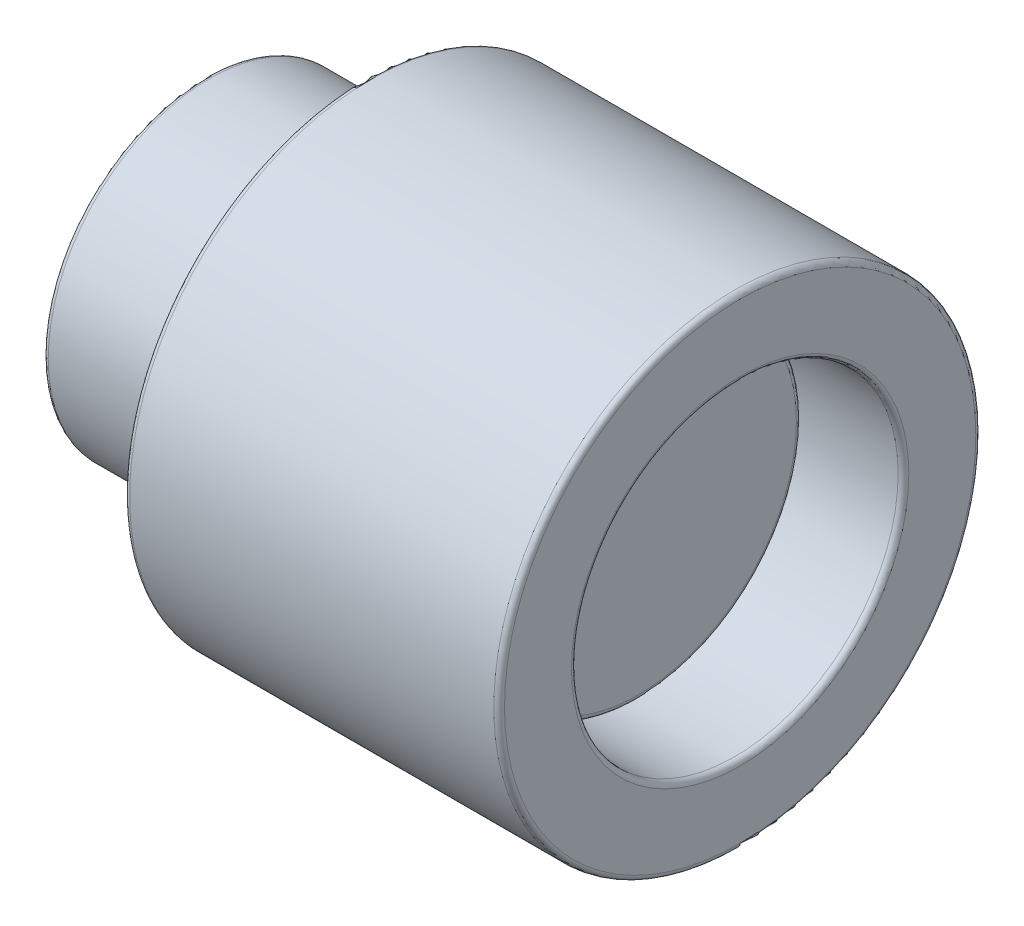
from build123d import *

# Parameters (mm, degrees)
SKETCH_1_R           = 4.5
SKETCH_1_R_2         = 3.05
EXTRUDE_1_DEPTH      = 7
EXTRUDE_2_DEPTH      = 3
EXTRUDE_2_DEPTH_BACK = 5.1
SKETCH_2_R           = 3.05
SKETCH_3_R           = 3.05
SKETCH_3_R_2         = 3.02
CUT_EXTRUDE_1_DEPTH  = 3
FILLET_1_R           = 0.1
FILLET_2_R           = 0.1
FILLET_3_R           = 0.1
FILLET_4_R           = 0.1


with BuildPart() as part:
    # 草图1 → 凸台-拉伸1 (new body)
    with BuildSketch(Plane(origin=(0, 0, 0), x_dir=(0, 0, -1), z_dir=(1, 0, 0))):
        Circle(SKETCH_1_R)
        Circle(SKETCH_1_R_2, mode=Mode.SUBTRACT)
    extrude(amount=EXTRUDE_1_DEPTH)

    # 圆角1
    fillet_1_edges = [part.edges().sort_by_distance(p)[0] for p in [
        (0, 0, 4.5),
        (7, 0, 4.5),
        (7, 0, 3.05),
    ]]
    fillet(fillet_1_edges, radius=FILLET_1_R)


with BuildPart() as body_2:
    # 草图2 → 凸台-拉伸2 (new, two sides: drawn at the far end of the back side and taken through both)
    with BuildSketch(Plane.ZY.offset(-EXTRUDE_2_DEPTH_BACK)):
        Circle(SKETCH_2_R)
    extrude(amount=EXTRUDE_2_DEPTH + EXTRUDE_2_DEPTH_BACK)

    # 草图3 → 切除-拉伸1 (cut)
    with BuildSketch(Plane.ZY.offset(3)):
        with Locations(Location((0, 0, 0), (0, 0, 180))):
            Circle(SKETCH_3_R)
        Circle(SKETCH_3_R_2, mode=Mode.SUBTRACT)
    extrude(amount=-CUT_EXTRUDE_1_DEPTH, mode=Mode.SUBTRACT)

    # 圆角2
    fillet_2_edges = [body_2.edges().sort_by_distance(p)[0] for p in [
        (-3, 0, -3.02),
    ]]
    fillet(fillet_2_edges, radius=FILLET_2_R)

    # 圆角3
    # the kernel refuses this fillet: 0.1 mm, written as the material it adds along each edge
    with BuildSketch(Plane(origin=(0, 0, 0), x_dir=(0, 0, 1), z_dir=(0, -1, 0))) as fillet_3_piece_1:
        with BuildLine():
            CenterArc((3.12, 0.071414284), FILLET_3_R, 180, 45.572995999)
            Line((3.05, 0), (3.0486, -0.001428286))
            ThreePointArc((3.0486, -0.001428286), (3.035, -0.002), (3.02, -0.002))
            Line((3.02, -0.002), (3.018, 0))
            Line((3.018, 0), (3.018, 0.071414284))
            Line((3.018, 0.071414284), (3.02, 0.071414284))
        make_face()
    revolve(axis=Axis((0, 0, 0), (-1, 0, 0)))

    # 圆角4
    fillet_4_edges = [body_2.edges().sort_by_distance(p)[0] for p in [
        (5.1, 0, -3.05),
    ]]
    fillet(fillet_4_edges, radius=FILLET_4_R)


solid = Compound([part.part, body_2.part])
